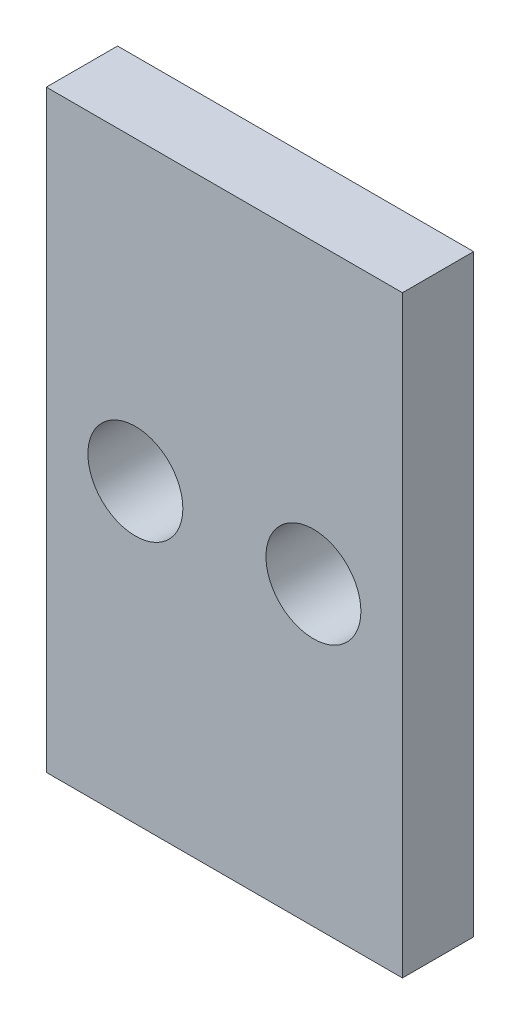
from build123d import *

# Parameters (mm, degrees)
SKETCH1_W           = 30
SKETCH1_H           = 50
SKETCH1_R           = 4
BOSS_EXTRUDE1_DEPTH = 6


with BuildPart() as part:
    # Sketch1 → Boss-Extrude1 (new body)
    with BuildSketch(Plane.XY):
        Rectangle(SKETCH1_W, SKETCH1_H)
        with Locations((-7.5, 0)):
            Circle(SKETCH1_R, mode=Mode.SUBTRACT)
        with Locations((7.5, 0)):
            Circle(SKETCH1_R, mode=Mode.SUBTRACT)
    extrude(amount=BOSS_EXTRUDE1_DEPTH)


solid = part.part
